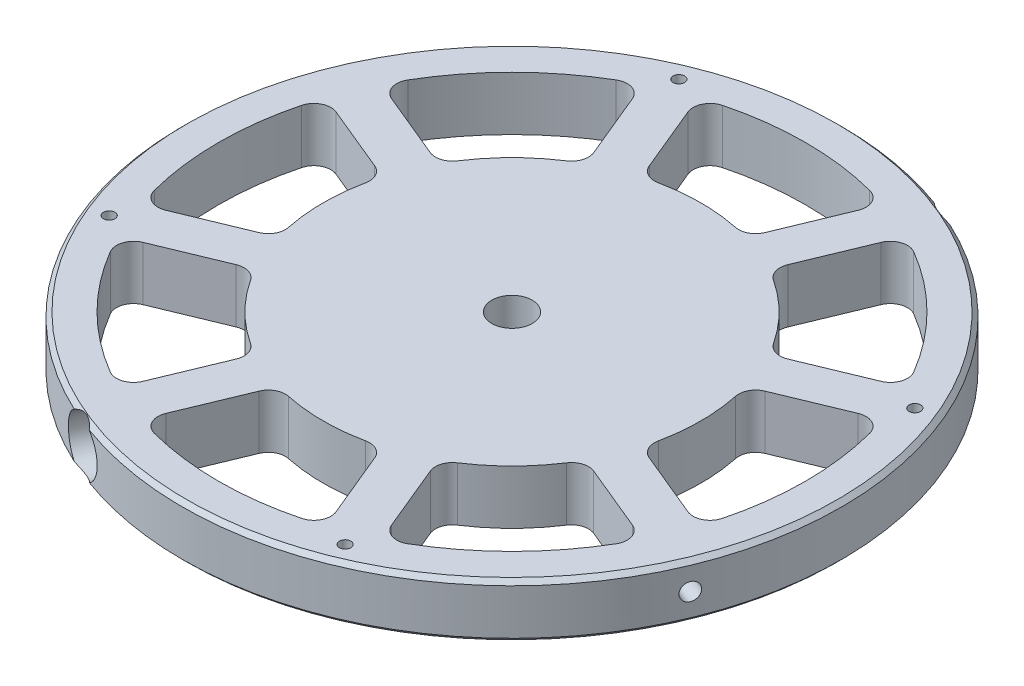
from build123d import *

# Parameters (mm, degrees)
SKETCH2_W                = 77.55
SKETCH2_H                = 12.7
F_6_32_TAPPED_HOLE2_D    = 2.7051
CIRPATTERN3_COUNT        = 4
CUT_EXTRUDE1_DEPTH       = 111.405140279
FILLET1_R                = 4
CIRPATTERN4_COUNT        = 8
FILLET1_OF_CIRPATTERN4_R = 4
CHAMFER1_SIZE            = 1
SKETCH15_W               = 2.0447
SKETCH15_H               = 101.323957926
SKETCH19_R               = 6.25
CUT_EXTRUDE3_DEPTH       = 5
CIRPATTERN5_COUNT        = 2
CIRPATTERN6_COUNT        = 2
SKETCH22_R               = 4.765
CUT_EXTRUDE4_DEPTH       = 12.8


with BuildPart() as part:
    # Sketch2 → Revolve1 (revolve)
    with BuildSketch(Plane(origin=(0, 0, 0), x_dir=(0, 0, -1), z_dir=(1, 0, 0))):
        with Locations((-38.775, 6.35)):
            Rectangle(SKETCH2_W, SKETCH2_H)
    revolve(axis=Axis((0, -0.75, 0), (0, 1, 0)))

    # #6-32 Tapped Hole2 (through all)
    with Locations(Plane(origin=(0, 12.7, 0), x_dir=(1, 0, 0), z_dir=(0, 1, 0))):
        with Locations((-27.763683018, 67.027460084)):
            f_6_32_tapped_hole2 = Hole(F_6_32_TAPPED_HOLE2_D / 2)

    # CirPattern3: #6-32 Tapped Hole2 ×4 about axis
    cirpattern3_axis = Axis((0, -0.75, 0), (0, 1, 0))
    for i in range(1, CIRPATTERN3_COUNT):
        add(f_6_32_tapped_hole2.rotate(cirpattern3_axis, i * 360 / CIRPATTERN3_COUNT), mode=Mode.SUBTRACT)

    # Sketch8 → Cut-Extrude1 (cut, through all)
    with BuildSketch(Plane(origin=(0, 12.7, 0), x_dir=(1, 0, 0), z_dir=(0, 1, 0))):
        with BuildLine():
            Line((-12.282922052, 42.719226653), (-21.735525784, 65.539830782))
            ThreePointArc((-21.735525784, 65.539830782), (0, 69.05), (21.735525784, 65.539830782))
            Line((21.735525784, 65.539830782), (12.282922052, 42.719226653))
            ThreePointArc((12.282922052, 42.719226653), (0, 44.45), (-12.282922052, 42.719226653))
        make_face()
    cut_extrude1 = extrude(amount=-CUT_EXTRUDE1_DEPTH, mode=Mode.SUBTRACT)

    # Fillet1
    fillet1_edges = [part.edges().sort_by_distance(p)[0] for p in [
        (12.282922052, 6.35, -42.719226653),
        (21.735525784, 6.35, -65.539830782),
        (-12.282922052, 6.35, -42.719226653),
        (-21.735525784, 6.35, -65.539830782),
    ]]
    fillet(fillet1_edges, radius=FILLET1_R)

    # CirPattern4: Cut-Extrude1 ×8 about axis
    cirpattern4_axis = Axis((0, -0.75, 0), (0, 1, 0))
    for i in range(1, CIRPATTERN4_COUNT):
        add(cut_extrude1.rotate(cirpattern4_axis, i * 360 / CIRPATTERN4_COUNT), mode=Mode.SUBTRACT)

    # Fillet1 of CirPattern4
    fillet1_of_cirpattern4_edges = [part.edges().sort_by_distance(p)[0] for p in [
        (-21.521717378, 6.35, -38.89239233),
        (-30.974321109, 6.35, -61.712996458),
        (-38.89239233, 6.35, -21.521717378),
        (-61.712996458, 6.35, -30.974321109),
        (-42.719226653, 6.35, -12.282922052),
        (-65.539830782, 6.35, -21.735525784),
        (-42.719226653, 6.35, 12.282922052),
        (-65.539830782, 6.35, 21.735525784),
        (-38.89239233, 6.35, 21.521717378),
        (-61.712996458, 6.35, 30.974321109),
        (-21.521717378, 6.35, 38.89239233),
        (-30.974321109, 6.35, 61.712996458),
        (-12.282922052, 6.35, 42.719226653),
        (-21.735525784, 6.35, 65.539830782),
        (12.282922052, 6.35, 42.719226653),
        (21.735525784, 6.35, 65.539830782),
        (21.521717378, 6.35, 38.89239233),
        (30.974321109, 6.35, 61.712996458),
        (38.89239233, 6.35, 21.521717378),
        (61.712996458, 6.35, 30.974321109),
        (42.719226653, 6.35, 12.282922052),
        (65.539830782, 6.35, 21.735525784),
        (42.719226653, 6.35, -12.282922052),
        (65.539830782, 6.35, -21.735525784),
        (38.89239233, 6.35, -21.521717378),
        (61.712996458, 6.35, -30.974321109),
        (21.521717378, 6.35, -38.89239233),
        (30.974321109, 6.35, -61.712996458),
    ]]
    fillet(fillet1_of_cirpattern4_edges, radius=FILLET1_OF_CIRPATTERN4_R)

    # Chamfer1
    chamfer1_edges = [part.edges().sort_by_distance(p)[0] for p in [
        (0, 0, -77.55),
        (0, 12.7, -77.55),
    ]]
    chamfer(chamfer1_edges, length=CHAMFER1_SIZE)

    # Sketch15 → #20 (0.161) Diameter Hole1 (revolve, cut)
    with BuildSketch(Plane(origin=(0, 6.35, 0), x_dir=(-0.38268343236508734, 0, 0.9238795325112877), z_dir=(0, 1, 0))):
        with Locations((1.02235, 50.661978963)):
            Rectangle(SKETCH15_W, SKETCH15_H)
    revolve(axis=Axis((-5.866635031, 6.35, -2.430039796), (0.9238795325112877, 0, 0.3826834323650874)), mode=Mode.SUBTRACT)

    # Sketch19 → Cut-Extrude3 (cut)
    with BuildSketch(Plane(origin=(29.67710018, 0, -71.646857746), x_dir=(-0.9238795325112891, 0, -0.38268343236508423), z_dir=(0.38268343236508423, 0, -0.9238795325112891))):
        with Locations((0, 6.35)):
            Circle(SKETCH19_R)
    cut_extrude3 = extrude(amount=-CUT_EXTRUDE3_DEPTH, mode=Mode.SUBTRACT)

    # CirPattern5: Cut-Extrude3 ×2 about axis
    cirpattern5_axis = Axis((0, -0.75, 0), (0, 1, 0))
    for i in range(1, CIRPATTERN5_COUNT):
        add(cut_extrude3.rotate(cirpattern5_axis, i * 360 / CIRPATTERN5_COUNT), mode=Mode.SUBTRACT)

    # Sketch21 → #10-24 Tapped Hole1 (revolve, cut)
    with BuildSketch(Plane(origin=(-27.763683018, 6.35, 67.027460084), x_dir=(0.9238795325112891, 0, 0.38268343236508423), z_dir=(0, 1, 0))):
        Polygon((0, 0), (0, 51.940824014), (1.89865, 50.8), (1.89865, 0), align=None)
    f_10_24_tapped_hole1 = revolve(axis=Axis((-30.193722814, 6.35, 72.894095115), (0.38268343236508423, 0, -0.923879532511289)), mode=Mode.SUBTRACT)

    # CirPattern6: #10-24 Tapped Hole1 ×2 about axis
    cirpattern6_axis = Axis((0, -0.75, 0), (0, 1, 0))
    for i in range(1, CIRPATTERN6_COUNT):
        add(f_10_24_tapped_hole1.rotate(cirpattern6_axis, i * 360 / CIRPATTERN6_COUNT), mode=Mode.SUBTRACT)

    # Sketch22 → Cut-Extrude4 (cut)
    with BuildSketch(Plane(origin=(0, 12.7, 0), x_dir=(1, 0, 0), z_dir=(0, 1, 0))):
        Circle(SKETCH22_R)
    extrude(amount=-CUT_EXTRUDE4_DEPTH, mode=Mode.SUBTRACT)


solid = part.part
